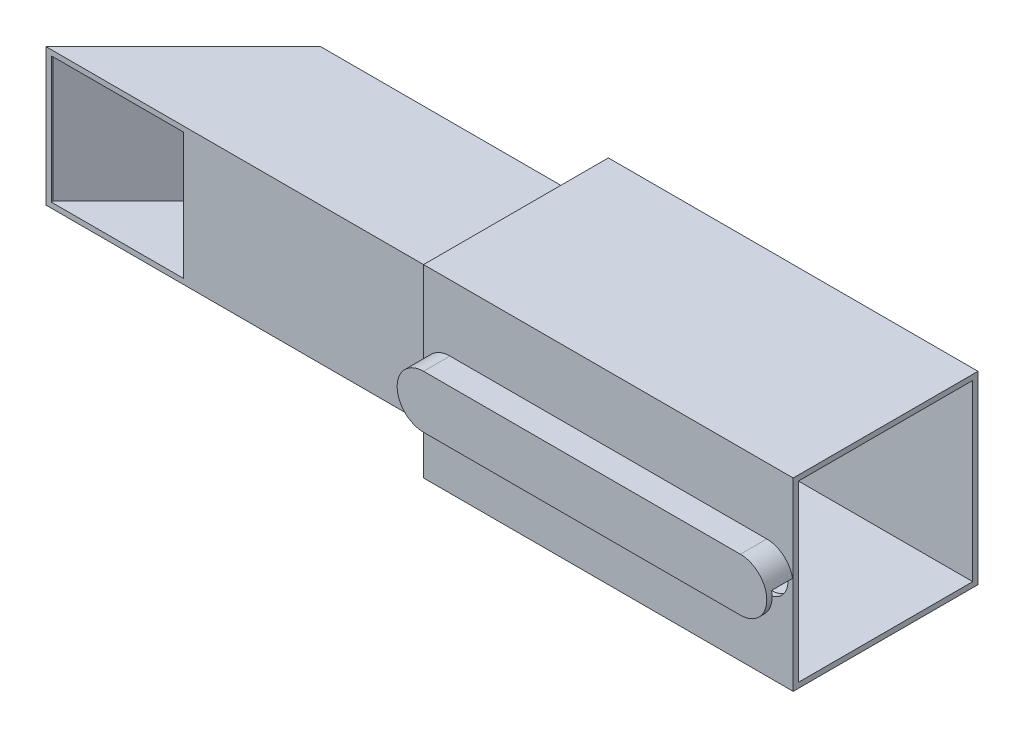
from build123d import *

# Parameters (mm, degrees)
SKETCH_4_W           = 70
SKETCH_4_H           = 35
EXTRUDE_6_DEPTH      = 17.5
EXTRUDE_7_DEPTH      = 5
SHELL_START          = -16.5
SHELL_3_OUTLINE_W    = 69
SHELL_3_OUTLINE_H    = 33
SHELL_3_DEPTH        = 33
SHELL_START_2        = 16.5
SHELL_3_2_DEPTH      = 5
SKETCH_9_W           = 70
SKETCH_9_H           = 4
CUT_EXTRUDE_1_DEPTH  = 6
SKETCH_22_W          = 50
SKETCH_22_H          = 26
EXTRUDE_8_DEPTH      = 13
SHELL_START_3        = -50
SHELL_4_OUTLINE_W    = 24
SHELL_4_OUTLINE_H    = 24
SHELL_4_DEPTH        = 50
SKETCH_23_W          = 24
SKETCH_23_H          = 24
CUT_EXTRUDE_3_DEPTH  = 1
EXTRUDE_11_DEPTH     = 13
SHELL_START_4        = -12
SHELL_13_DEPTH       = 24
CUT_EXTRUDE_16_REACH = 85.741
SKETCH_40_W          = 25
SKETCH_40_H          = 24


# Read off the part's stored shape, not the designer's step: 抽壳3, 抽壳4, 抽壳13
with BuildPart() as part:
    # 草图4 → 凸台-拉伸6 (new, symmetric)
    with BuildSketch(Plane.XY):
        with Locations((35, 0)):
            Rectangle(SKETCH_4_W, SKETCH_4_H)
    extrude(amount=EXTRUDE_6_DEPTH, both=True)

    # 草图6 → 凸台-拉伸7 (add)
    with BuildSketch(Plane.XY.offset(22.5)):
        with BuildLine():
            Line((5, 5), (65, 5))
            ThreePointArc((65, 5), (70, 0), (65, -5))
            Line((65, -5), (5, -5))
            ThreePointArc((5, -5), (0, 0), (5, 5))
        make_face()
    extrude(amount=-EXTRUDE_7_DEPTH)

    # 抽壳3 outline → 抽壳3 (cut)
    with BuildSketch(Plane.XY.offset(SHELL_START)):
        with Locations((35.5, 0)):
            Rectangle(SHELL_3_OUTLINE_W, SHELL_3_OUTLINE_H)
    extrude(amount=SHELL_3_DEPTH, mode=Mode.SUBTRACT)

    # Shell 3 2 outline → Shell 3 2 (cut)
    with BuildSketch(Plane.XY.offset(SHELL_START_2)):
        with BuildLine():
            ThreePointArc((5, 4), (1, 0), (5, -4))
            Line((5, -4), (65, -4))
            ThreePointArc((65, -4), (69, 0), (65, 4))
            Line((65, 4), (5, 4))
        make_face()
    extrude(amount=SHELL_3_2_DEPTH, mode=Mode.SUBTRACT)

    # 草图9 → 切除-拉伸1 (cut)
    with BuildSketch(Plane.XZ.offset(5)):
        with Locations((35, 19.5)):
            Rectangle(SKETCH_9_W, SKETCH_9_H)
    extrude(amount=-CUT_EXTRUDE_1_DEPTH, mode=Mode.SUBTRACT)

    # 草图22 → 凸台-拉伸8 (add, symmetric)
    with BuildSketch(Plane.XY):
        with Locations((-25, 0)):
            Rectangle(SKETCH_22_W, SKETCH_22_H)
    extrude(amount=EXTRUDE_8_DEPTH, both=True)

    # 抽壳4 outline → 抽壳4 (cut)
    with BuildSketch(Plane.YZ.offset(SHELL_START_3)):
        Rectangle(SHELL_4_OUTLINE_W, SHELL_4_OUTLINE_H)
    extrude(amount=SHELL_4_DEPTH, mode=Mode.SUBTRACT)

    # 草图23 → 切除-拉伸3 (cut)
    with BuildSketch(Plane.ZY):
        Rectangle(SKETCH_23_W, SKETCH_23_H)
    extrude(amount=-CUT_EXTRUDE_3_DEPTH, mode=Mode.SUBTRACT)

    # 草图28 → 凸台-拉伸11 (add, symmetric)
    with BuildSketch(Plane(origin=(0, 0, 0), x_dir=(1, 0, 0), z_dir=(0, 1, 0))):
        Polygon((-50, 13), (-50, -13), (-76, -13), align=None)
    extrude(amount=EXTRUDE_11_DEPTH, both=True)

    # 抽壳13 outline → 抽壳13 (cut)
    with BuildSketch(Plane(origin=(0, 0, 0), x_dir=(1, 0, 0), z_dir=(0, 1, 0)).offset(SHELL_START_4)):
        Polygon((-50, 11.585786438), (-73.585786438, -12), (-50, -12), align=None)
    extrude(amount=SHELL_13_DEPTH, mode=Mode.SUBTRACT)

    # 切除-拉伸16: up to this plane
    cut_extrude_16_end = Plane(origin=(-75.646446609, 13, 13.353553391), z_dir=(0.7071067811865512, 0, 0.7071067811865439))
    # 草图40 → 切除-拉伸16 (cut, up to the surface)
    with BuildSketch(Plane.XY.offset(13), mode=Mode.PRIVATE) as cut_extrude_16_sk1:
        with Locations((-62.5, 0)):
            Rectangle(SKETCH_40_W, SKETCH_40_H)
    cut_extrude_16_tool1 = split(extrude(cut_extrude_16_sk1.sketch, amount=-CUT_EXTRUDE_16_REACH, mode=Mode.PRIVATE), bisect_by=cut_extrude_16_end, keep=Keep.BOTH, mode=Mode.PRIVATE)
    add(cut_extrude_16_tool1.solids().sort_by_distance((-62.5, 0, 13))[0], mode=Mode.SUBTRACT)


solid = part.part
